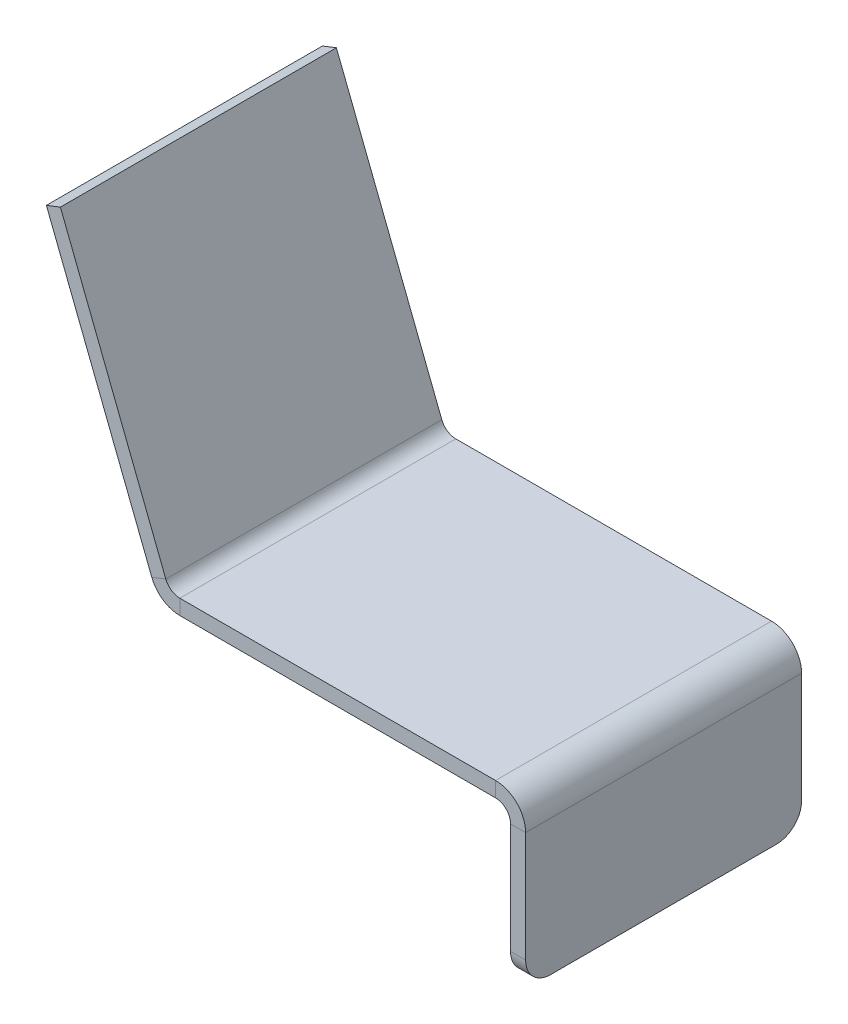
from build123d import *

# Parameters (mm, degrees)
SM_BASE_FLANGE_1_DEPTH = 110
FILLET_1_R             = 10


# Sheet-metal steps are written as plain solids
with BuildPart() as part:
    # Sketch 1 → 基体-法兰1 (new body)
    with BuildSketch(Plane.XY):
        with BuildLine():
            Line((0, 0), (42.015440419, -107.372792183))
            ThreePointArc((42.015440419, -107.372792183), (46.425499978, -112.91144556), (53.190353776, -115))
            Line((53.190353776, -115), (179, -115))
            ThreePointArc((179, -115), (183.242640687, -116.757359313), (185, -121))
            Line((185, -121), (185, -175))
            Line((185, -175), (191, -175))
            Line((191, -175), (191, -121))
            ThreePointArc((191, -121), (187.485281374, -112.514718626), (179, -109))
            Line((179, -109), (53.190353776, -109))
            ThreePointArc((53.190353776, -109), (49.807926877, -107.95572278), (47.602897098, -105.186396091))
            Line((47.602897098, -105.186396091), (5.587456678, 2.186396091))
            Line((5.587456678, 2.186396091), (0, 0))
        make_face()
    extrude(amount=SM_BASE_FLANGE_1_DEPTH)

    # 圆角1
    fillet_1_edges = [part.edges().sort_by_distance(p)[0] for p in [
        (188, -175, 0),
        (188, -175, 110),
    ]]
    fillet(fillet_1_edges, radius=FILLET_1_R)


solid = part.part
